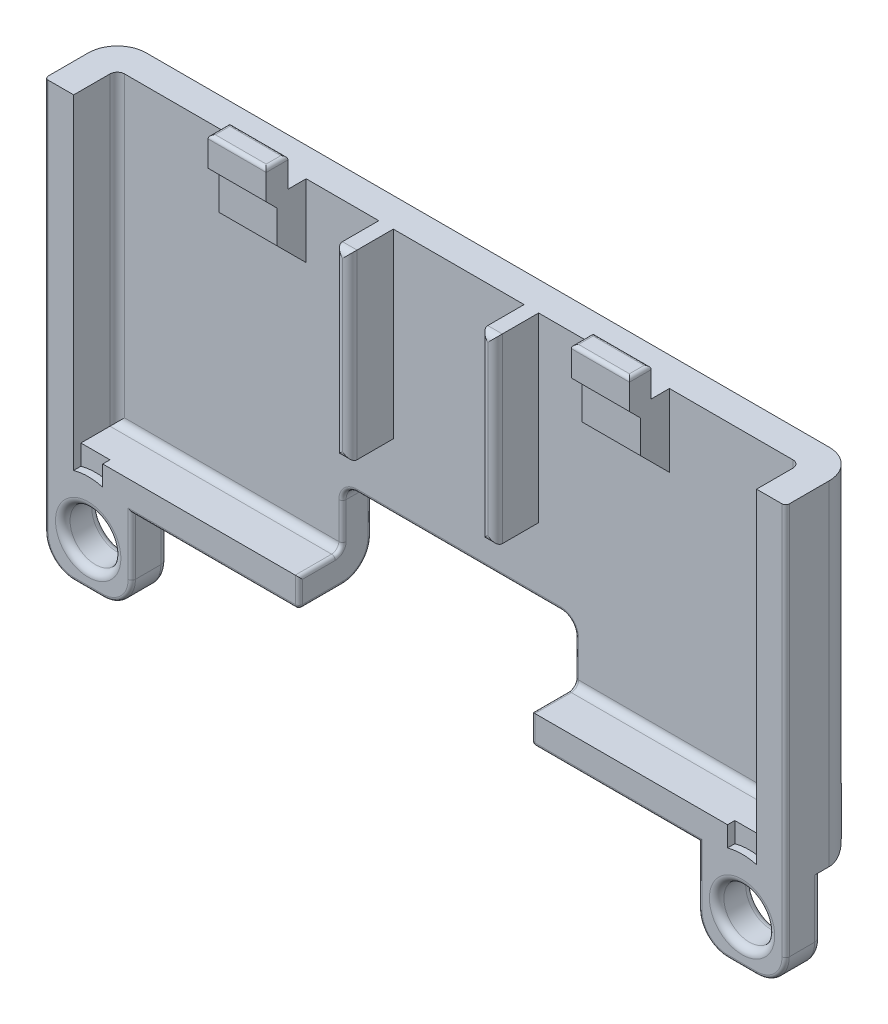
from build123d import *

# Parameters (mm, degrees)
CROQUIS1_R              = 1.75
SALIENTE_EXTRUIR1_DEPTH = 5
CROQUIS2_W              = 51.235459784
CROQUIS2_H              = 7.088807175
CORTAR_EXTRUIR1_DEPTH   = 2.5
REDONDEO2_R             = 2
VACIADO1_START          = -3
VACIADO1_OUTLINE_W      = 47
VACIADO1_OUTLINE_H      = 21
VACIADO1_DEPTH          = 3
VACIADO1_START_2        = -0.5
VACIADO1_2_DEPTH        = 0.5
CROQUIS3_W              = 16
CROQUIS3_H              = 12
CORTAR_EXTRUIR2_DEPTH   = 5
REDONDEO3_R             = 1
CORTAR_EXTRUIR3_DEPTH   = 62
CROQUIS5_W              = 1
CROQUIS5_H              = 12.5
SALIENTE_EXTRUIR2_DEPTH = 3
CROQUIS6_W              = 4
CROQUIS6_H              = 5
SALIENTE_EXTRUIR3_DEPTH = 3
CROQUIS7_W              = 4
CROQUIS7_H              = 1.25
CROQUIS7_H_2            = 0.25
CORTAR_EXTRUIR4_DEPTH   = 2
CROQUIS8_W              = 4
CROQUIS8_H              = 3
CORTAR_EXTRUIR5_DEPTH   = 1
CHAFL_N1_SIZE           = 2
REDONDEO4_R             = 0.5
REDONDEO5_R             = 0.25
REDONDEO6_R             = 0.5
CHAFL_N2_SIZE           = 0.75
REDONDEO7_R             = 0.25


# Read off the part's stored shape, not the designer's step: Vaciado1
with BuildPart() as part:
    # Croquis1 → Saliente-Extruir1 (new body)
    with BuildSketch(Plane.XY):
        with BuildLine():
            Line((-25.5, 12.686598493), (-25.5, -14.313401507))
            ThreePointArc((-25.5, -14.313401507), (-24.914213562, -15.727615069), (-23.5, -16.313401507))
            Line((-23.5, -16.313401507), (-21.5, -16.313401507))
            ThreePointArc((-21.5, -16.313401507), (-20.085786438, -15.727615069), (-19.5, -14.313401507))
            Line((-19.5, -14.313401507), (-19.5, -10.313401507))
            Line((-19.5, -10.313401507), (19.5, -10.313401507))
            Line((19.5, -10.313401507), (19.5, -14.313401507))
            ThreePointArc((19.5, -14.313401507), (20.085786438, -15.727615069), (21.5, -16.313401507))
            Line((21.5, -16.313401507), (23.5, -16.313401507))
            ThreePointArc((23.5, -16.313401507), (24.914213562, -15.727615069), (25.5, -14.313401507))
            Line((25.5, -14.313401507), (25.5, 12.686598493))
            ThreePointArc((25.5, 12.686598493), (24.914213562, 14.100812055), (23.5, 14.686598493))
            Line((23.5, 14.686598493), (-23.5, 14.686598493))
            ThreePointArc((-23.5, 14.686598493), (-24.914213562, 14.100812055), (-25.5, 12.686598493))
        make_face()
        with Locations((-22.5, -13.313401507)):
            Circle(CROQUIS1_R, mode=Mode.SUBTRACT)
        with Locations((22.5, -13.313401507)):
            Circle(CROQUIS1_R, mode=Mode.SUBTRACT)
    extrude(amount=-SALIENTE_EXTRUIR1_DEPTH)

    # Croquis2 → Cortar-Extruir1 (cut)
    with BuildSketch(Plane(origin=(0, 0, -5), x_dir=(-1, 0, 0), z_dir=(0, 0, -1))):
        with Locations((0.117729892, -13.857805095)):
            Rectangle(CROQUIS2_W, CROQUIS2_H)
    extrude(amount=-CORTAR_EXTRUIR1_DEPTH, mode=Mode.SUBTRACT)

    # Redondeo2
    redondeo2_edges = [part.edges().sort_by_distance(p)[0] for p in [
        (0, -10.313401507, -5),
        (-24.914213562, 14.100812055, -5),
        (24.914213562, 14.100812055, -5),
        (0, 14.686598493, -5),
        (25.5, 1.186598493, -5),
        (-25.5, 1.186598493, -5),
    ]]
    fillet(redondeo2_edges, radius=REDONDEO2_R)

    # Vaciado1 outline → Vaciado1 (cut)
    with BuildSketch(Plane.XY.offset(VACIADO1_START)):
        with Locations((0, 2.186598493)):
            Rectangle(VACIADO1_OUTLINE_W, VACIADO1_OUTLINE_H)
    extrude(amount=VACIADO1_DEPTH, mode=Mode.SUBTRACT)

    # Vaciado1 2 outline → Vaciado1 2 (cut)
    with BuildSketch(Plane.XY.offset(VACIADO1_START_2)):
        with BuildLine():
            Line((23.5, -8.313401507), (21.5, -8.313401507))
            Line((21.5, -8.313401507), (21.5, -9.699193433))
            ThreePointArc((21.5, -9.699193433), (22.5, -9.563401507), (23.5, -9.699193433))
            Line((23.5, -9.699193433), (23.5, -8.313401507))
        make_face()
        with BuildLine():
            Line((-21.5, -9.699193433), (-21.5, -8.313401507))
            Line((-21.5, -8.313401507), (-23.5, -8.313401507))
            Line((-23.5, -8.313401507), (-23.5, -9.699193433))
            ThreePointArc((-23.5, -9.699193433), (-22.5, -9.563401507), (-21.5, -9.699193433))
        make_face()
    extrude(amount=VACIADO1_2_DEPTH, mode=Mode.SUBTRACT)

    # Croquis3 → Cortar-Extruir2 (cut)
    with BuildSketch(Plane(origin=(0, 0, -5), x_dir=(-1, 0, 0), z_dir=(0, 0, -1))):
        with Locations((0, -10.313401507)):
            Rectangle(CROQUIS3_W, CROQUIS3_H)
    extrude(amount=-CORTAR_EXTRUIR2_DEPTH, mode=Mode.SUBTRACT)

    # Redondeo3
    redondeo3_edges = [part.edges().sort_by_distance(p)[0] for p in [
        (-8, -4.313401507, -4),
        (8, -4.313401507, -4),
    ]]
    fillet(redondeo3_edges, radius=REDONDEO3_R)

    # Croquis4 → Cortar-Extruir3 (cut)
    with BuildSketch(Plane(origin=(25.5, 0, 0), x_dir=(0, 0, -1), z_dir=(1, 0, 0))):
        Polygon((0, 12.686598493), (3, 12.686598493), (5, 12.686598493), (5, 16.306246872), (0, 16.306246872), align=None)
    extrude(amount=-CORTAR_EXTRUIR3_DEPTH, mode=Mode.SUBTRACT)

    # Croquis5 → Saliente-Extruir2 (add)
    with BuildSketch(Plane.XY.offset(-3)):
        with Locations((-5, 6.436598493)):
            Rectangle(CROQUIS5_W, CROQUIS5_H)
        with Locations((5, 6.436598493)):
            Rectangle(CROQUIS5_W, CROQUIS5_H)
    extrude(amount=SALIENTE_EXTRUIR2_DEPTH)

    # Croquis6 → Saliente-Extruir3 (add)
    with BuildSketch(Plane.XY.offset(-3)):
        with Locations((-12.5, 12.186598493)):
            Rectangle(CROQUIS6_W, CROQUIS6_H)
        with Locations((12.5, 12.186598493)):
            Rectangle(CROQUIS6_W, CROQUIS6_H)
    extrude(amount=SALIENTE_EXTRUIR3_DEPTH)

    # Croquis7 → Cortar-Extruir4 (cut)
    with BuildSketch(Plane(origin=(0, 14.686598493, 0), x_dir=(1, 0, 0), z_dir=(0, 1, 0))):
        with Locations((-12.5, 2.375)):
            Rectangle(CROQUIS7_W, CROQUIS7_H)
        with Locations((12.5, 2.375)):
            Rectangle(CROQUIS7_W, CROQUIS7_H)
        with Locations((12.5, 0.125)):
            Rectangle(CROQUIS7_W, CROQUIS7_H_2)
        with Locations((-12.5, 0.125)):
            Rectangle(CROQUIS7_W, CROQUIS7_H_2)
    extrude(amount=-CORTAR_EXTRUIR4_DEPTH, mode=Mode.SUBTRACT)

    # Croquis8 → Cortar-Extruir5 (cut)
    with BuildSketch(Plane.XY):
        with Locations((12.5, 11.186598493)):
            Rectangle(CROQUIS8_W, CROQUIS8_H)
        with Locations((-12.5, 11.186598493)):
            Rectangle(CROQUIS8_W, CROQUIS8_H)
    extrude(amount=-CORTAR_EXTRUIR5_DEPTH, mode=Mode.SUBTRACT)

    # Chaflán1
    chafl_n1_edges = [part.edges().sort_by_distance(p)[0] for p in [
        (12.5, 9.686598493, -3),
        (-12.5, 9.686598493, -3),
    ]]
    chamfer(chafl_n1_edges, length=CHAFL_N1_SIZE - 0.0001)  # a hair under: the kernel refuses the full size

    # Redondeo4
    redondeo4_edges = [part.edges().sort_by_distance(p)[0] for p in [
        (-24.25, -13.313401507, 0),
        (20.75, -13.313401507, 0),
        (25.5, -12.313401507, -2.5),
        (22.5, -16.313401507, -2.5),
        (24.914213562, -15.727615069, -2.5),
        (19.5, -12.313401507, -2.5),
        (20.085786438, -15.727615069, -2.5),
        (-20.085786438, -15.727615069, -2.5),
        (-19.5, -12.313401507, -2.5),
        (-25.5, -12.313401507, -2.5),
        (-24.914213562, -15.727615069, -2.5),
        (-22.5, -16.313401507, -2.5),
        (-24.25, -13.313401507, -2.5),
        (20.75, -13.313401507, -2.5),
    ]]
    fillet(redondeo4_edges, radius=REDONDEO4_R)

    # Redondeo5
    redondeo5_edges = [part.edges().sort_by_distance(p)[0] for p in [
        (25.5, -0.813401507, 0),
        (24.914213562, -15.727615069, 0),
        (13.75, -10.313401507, 0),
        (22.5, -16.313401507, 0),
        (20.085786438, -15.727615069, 0),
        (19.5, -12.313401507, 0),
        (-13.75, -10.313401507, 0),
        (-19.5, -12.313401507, 0),
        (-20.085786438, -15.727615069, 0),
        (-22.5, -16.313401507, 0),
        (-24.914213562, -15.727615069, 0),
        (-25.5, -0.813401507, 0),
    ]]
    fillet(redondeo5_edges, radius=REDONDEO5_R)

    # Redondeo6
    redondeo6_edges = [part.edges().sort_by_distance(p)[0] for p in [
        (23.5, 2.186598493, -3),
        (15.75, -8.313401507, -3),
        (-23.5, 2.186598493, -3),
        (-15.75, -8.313401507, -3),
        (-5, 12.686598493, 0),
        (-5.5, 6.436598493, 0),
        (-5, 0.186598493, 0),
        (-4.5, 6.436598493, 0),
        (5, 12.686598493, 0),
        (4.5, 6.436598493, 0),
        (5, 0.186598493, 0),
        (5.5, 6.436598493, 0),
    ]]
    fillet(redondeo6_edges, radius=REDONDEO6_R - 0.0001)  # a hair under: the kernel refuses the full size

    # Chaflán2
    chafl_n2_edges = [part.edges().sort_by_distance(p)[0] for p in [
        (12.5, 12.686598493, -1),
        (-12.5, 12.686598493, -1),
    ]]
    chamfer(chafl_n2_edges, length=CHAFL_N2_SIZE - 0.0001)  # a hair under: the kernel refuses the full size

    # Redondeo7
    redondeo7_edges = [part.edges().sort_by_distance(p)[0] for p in [
        (-8, -6.813401507, -5),
        (-8, -9.727615069, -4.414213562),
        (-8, -8.313401507, -1.25005),
        (8, -9.727615069, -4.414213562),
        (8, -10.313401507, -1.625),
        (8, -9.188401507, 0),
        (8, -6.813401507, -5),
        (0, -4.313401507, -3),
        (0, -4.313401507, -5),
        (-8, -6.563451507, -3),
        (7.707106781, -4.606294726, -5),
        (7.707106781, -4.606294726, -3),
        (-7.707106781, -4.606294726, -5),
        (-7.707106781, -4.606294726, -3),
        (-12.5, 14.686598493, -1.75),
        (10.5, 14.686598493, -1),
        (14.5, 14.686598493, -1),
        (-10.5, 14.686598493, -1),
        (-14.5, 14.686598493, -1),
        (12.5, 14.686598493, -1.75),
        (12.5, 14.686598493, -0.25),
        (-12.5, 14.686598493, -0.25),
        (-8, -9.188401507, 0),
        (8, -10.240178202, -0.073223305),
        (-8, -10.313401507, -1.625),
        (-8, -10.240178202, -0.073223305),
        (8, -6.563451507, -3),
        (8, -8.313401507, -1.25005),
        (8, -8.166984187, -2.85358268),
        (-8, -8.166984187, -2.85358268),
    ]]
    fillet(redondeo7_edges, radius=REDONDEO7_R)


solid = part.part
